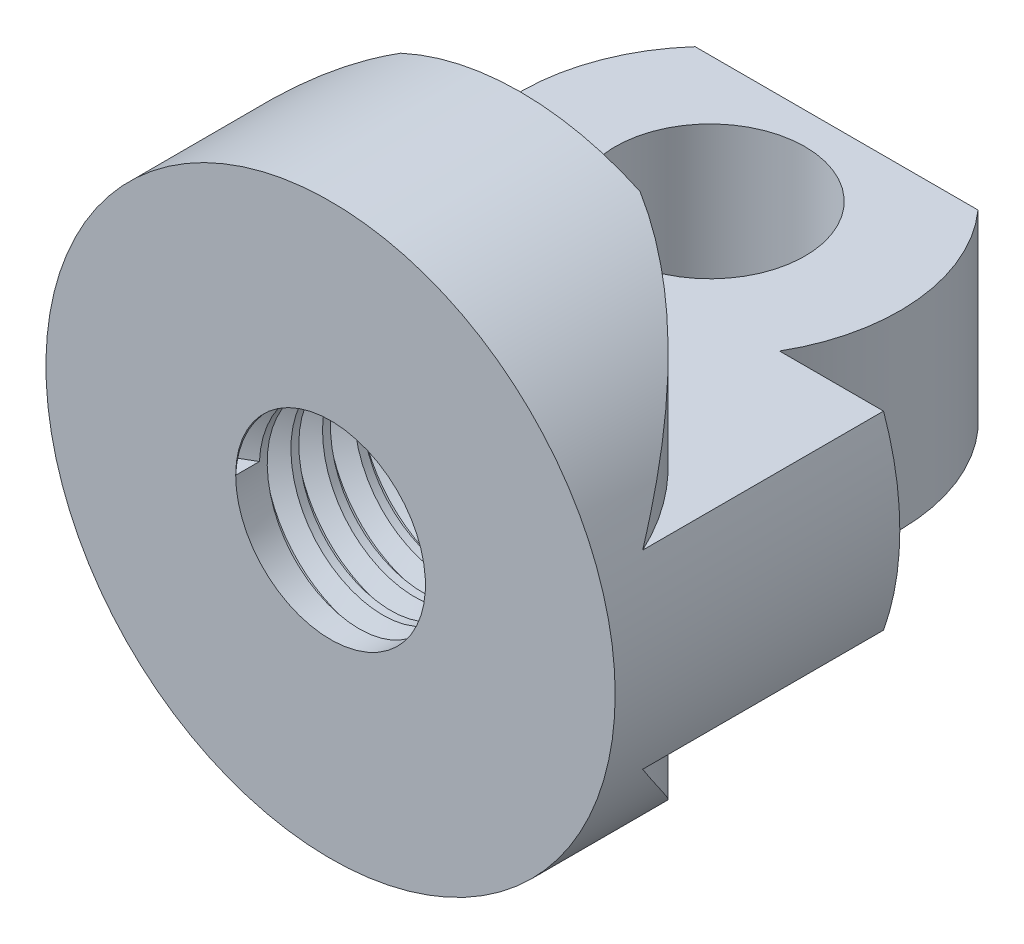
from build123d import *
from build123d.topology import SkipClean

# Parameters (mm, degrees)
CROQUIS1_R              = 4.5
CROQUIS1_R_2            = 1.5
SALIENTE_EXTRUIR2_DEPTH = 3
ROSCA1_PITCH            = 0.5
CROQUIS5_W              = 9
CROQUIS5_H              = 5
CROQUIS5_R              = 1.5
SALIENTE_EXTRUIR3_DEPTH = 4
CORTAR_EXTRUIR3_START   = -10
CORTAR_EXTRUIR3_DEPTH   = 10
CROQUIS7_W              = 5
CROQUIS7_H              = 3
CORTAR_EXTRUIR4_DEPTH   = 10
CORTAR_EXTRUIR6_DEPTH   = 10
CROQUIS10_W             = 0.257359313
CROQUIS10_H             = 3.5
CORTAR_EXTRUIR7_DEPTH   = 10


with BuildPart() as part:
    # Croquis1 → Saliente-Extruir2 (new body)
    with BuildSketch(Plane.XY):
        Circle(CROQUIS1_R)
        Circle(CROQUIS1_R_2, mode=Mode.SUBTRACT)
    extrude(amount=SALIENTE_EXTRUIR2_DEPTH)

    # Rosca1: the profile of Perfil de rosca1 profile screwed along a right-hand helix of 6 turns, 6 arcs to a turn; built about Z, then put on its axis
    rosca1_z = Axis((0, 0, 0), (0, 0, 1))
    rosca1_corners = [(1.4997, 0, -0.000173205), (1.770632938, 0, 0.156249999), (1.770632938, 0, 0.218749999), (1.4997, 0, 0.375173204)]
    with BuildLine(mode=Mode.PRIVATE) as rosca1_profile:
        Line(rosca1_corners[0], rosca1_corners[1])
        Line(rosca1_corners[1], rosca1_corners[2])
        Line(rosca1_corners[2], rosca1_corners[3])
        Line(rosca1_corners[3], rosca1_corners[0])
    rosca1_cap = Face(rosca1_profile.wire())
    rosca1_turn_angles = [0, 30, 60, 90, 120, 150, 180, 210, 240, 270, 300, 330, 360]
    rosca1_turn_weights = [1, 0.8660254037844387, 1, 0.8660254037844387, 1, 0.8660254037844387, 1, 0.8660254037844387, 1, 0.8660254037844387, 1, 0.8660254037844387, 1]
    rosca1_turn_rails = [Edge.make_bspline([Vector(p[0], p[1], 0).rotate(rosca1_z, rosca1_turn_angles[k]) / rosca1_turn_weights[k] + Vector(0, 0, p[2] + ROSCA1_PITCH * rosca1_turn_angles[k] / 360) for k in range(13)], [0, 0, 0, 1, 1, 2, 2, 3, 3, 4, 4, 5, 5, 6, 6, 6], 2, rosca1_turn_weights) for p in rosca1_corners]
    rosca1_turn_sides = [Face.make_surface_from_curves(rosca1_turn_rails[p[0]], rosca1_turn_rails[p[1]]) for p in [(0, 1), (1, 2), (2, 3), (3, 0)]]
    rosca1 = Plane(origin=(0, 0, 3), x_dir=(-1, 0, 0), z_dir=(0, 0, -1)) * Solid(Shell([*[p.moved(Location((0, 0, ROSCA1_PITCH * i))) for i in range(6) for p in rosca1_turn_sides], rosca1_cap, rosca1_cap.rotate(rosca1_z, 2160).moved(Location((0, 0, ROSCA1_PITCH * 2160 / 360)))]))
    add(rosca1, mode=Mode.SUBTRACT)

    # Croquis5 → Saliente-Extruir3 (add, symmetric)
    with BuildSketch(Plane(origin=(0, 0, 0), x_dir=(1, 0, 0), z_dir=(0, 1, 0))):
        with Locations((0, 2.5)):
            Rectangle(CROQUIS5_W, CROQUIS5_H)
        with Locations(Location((0, 3, 0), (0, 0, 270))):
            Circle(CROQUIS5_R, mode=Mode.SUBTRACT)
    extrude(amount=SALIENTE_EXTRUIR3_DEPTH, both=True)

    # Croquis6 → Cortar-Extruir3 (cut)
    with SkipClean():  # the faces are left unmerged after this step: merging them gives an invalid solid
        with BuildSketch(Plane.XY.offset(CORTAR_EXTRUIR3_START)):
            with BuildLine():
                Line((-4.5, 4), (-4.5, 0))
                ThreePointArc((-4.5, 0), (-3.842329219, 2.342329219), (-2.061552813, 4))
                Line((-2.061552813, 4), (-4.5, 4))
            make_face()
            with BuildLine():
                Line((4.5, 4), (2.061552813, 4))
                ThreePointArc((2.061552813, 4), (3.842329219, 2.342329219), (4.5, 0))
                Line((4.5, 0), (4.5, 4))
            make_face()
            with BuildLine():
                Line((4.5, -4), (4.5, 0))
                ThreePointArc((4.5, 0), (3.842329219, -2.342329219), (2.061552813, -4))
                Line((2.061552813, -4), (4.5, -4))
            make_face()
            with BuildLine():
                Line((-4.5, 0), (-4.5, -4))
                Line((-4.5, -4), (-2.061552813, -4))
                ThreePointArc((-2.061552813, -4), (-3.842329219, -2.342329219), (-4.5, 0))
            make_face()
        extrude(amount=CORTAR_EXTRUIR3_DEPTH, mode=Mode.SUBTRACT)

    # Croquis7 → Cortar-Extruir4 (cut, symmetric)
    with SkipClean():  # the faces are left unmerged after this step: merging them gives an invalid solid
        with BuildSketch(Plane(origin=(0, 0, 0), x_dir=(0, 0, -1), z_dir=(1, 0, 0))):
            with Locations((2.5, 3)):
                Rectangle(CROQUIS7_W, CROQUIS7_H)
            with Locations((2.5, -3)):
                Rectangle(CROQUIS7_W, CROQUIS7_H)
        extrude(amount=CORTAR_EXTRUIR4_DEPTH, both=True, mode=Mode.SUBTRACT)

    # Croquis9 → Cortar-Extruir6 (cut)
    with SkipClean():  # the faces are left unmerged after this step: merging them gives an invalid solid
        with BuildSketch(Plane(origin=(0, 1.5, 0), x_dir=(1, 0, 0), z_dir=(0, 1, 0))):
            with BuildLine():
                Line((-4.242640687, 0), (-1.892710475, 0))
                ThreePointArc((-1.892710475, 0), (-0.967258097, 0.298907677), (1e-08, 0.4))
                Line((1e-08, 0.4), (-4.242640687, 0.4))
                Line((-4.242640687, 0.4), (-4.242640687, 0))
            make_face()
            with BuildLine():
                Line((-4.5, 0.4), (-4.5, -3))
                ThreePointArc((-4.5, -3), (-3.530819565, -1.20931822), (-1.892710475, 0))
                Line((-1.892710475, 0), (-4.242640687, 0))
                Line((-4.242640687, 0), (-4.242640687, 0.4))
                Line((-4.242640687, 0.4), (-4.5, 0.4))
            make_face()
            with BuildLine():
                ThreePointArc((1e-08, 0.4), (0.967258107, 0.298907675), (1.892710475, 0))
                Line((1.892710475, 0), (4.242640687, 0))
                Line((4.242640687, 0), (4.242640687, 0.4))
                Line((4.242640687, 0.4), (1e-08, 0.4))
            make_face()
            with BuildLine():
                ThreePointArc((1.892710475, 0), (3.530819565, -1.20931822), (4.5, -3))
                Line((4.5, -3), (4.5, 0.4))
                Line((4.5, 0.4), (4.242640687, 0.4))
                Line((4.242640687, 0.4), (4.242640687, 0))
                Line((4.242640687, 0), (1.892710475, 0))
            make_face()
        cortar_extruir6 = extrude(amount=CORTAR_EXTRUIR6_DEPTH, mode=Mode.SUBTRACT)

    # Simetría1: Cortar-Extruir6 across plane
    with SkipClean():  # the faces are left unmerged after this step: merging them gives an invalid solid
        add(cortar_extruir6.mirror(Plane.ZX), mode=Mode.SUBTRACT)

    # Croquis10 → Cortar-Extruir7 (cut)
    with SkipClean():  # the faces are left unmerged after this step: merging them gives an invalid solid
        with BuildSketch(Plane(origin=(0, 1.5, 0), x_dir=(1, 0, 0), z_dir=(0, 1, 0))):
            with BuildLine():
                Line((-4.242640687, 5), (-4.242640687, 1.5))
                Line((-4.242640687, 1.5), (-2.598076211, 1.5))
                ThreePointArc((-2.598076211, 1.5), (-2.984080681, 3.308646222), (-2.236067977, 5))
                Line((-2.236067977, 5), (-4.242640687, 5))
            make_face()
            with BuildLine():
                ThreePointArc((2.236067977, 5), (2.984080681, 3.308646222), (2.598076211, 1.5))
                Line((2.598076211, 1.5), (4.242640687, 1.5))
                Line((4.242640687, 1.5), (4.242640687, 5))
                Line((4.242640687, 5), (2.236067977, 5))
            make_face()
            with Locations((-4.371320344, 3.25)):
                Rectangle(CROQUIS10_W, CROQUIS10_H)
            with Locations((4.371320344, 3.25)):
                Rectangle(CROQUIS10_W, CROQUIS10_H)
        extrude(amount=-CORTAR_EXTRUIR7_DEPTH, mode=Mode.SUBTRACT)


solid = part.part
